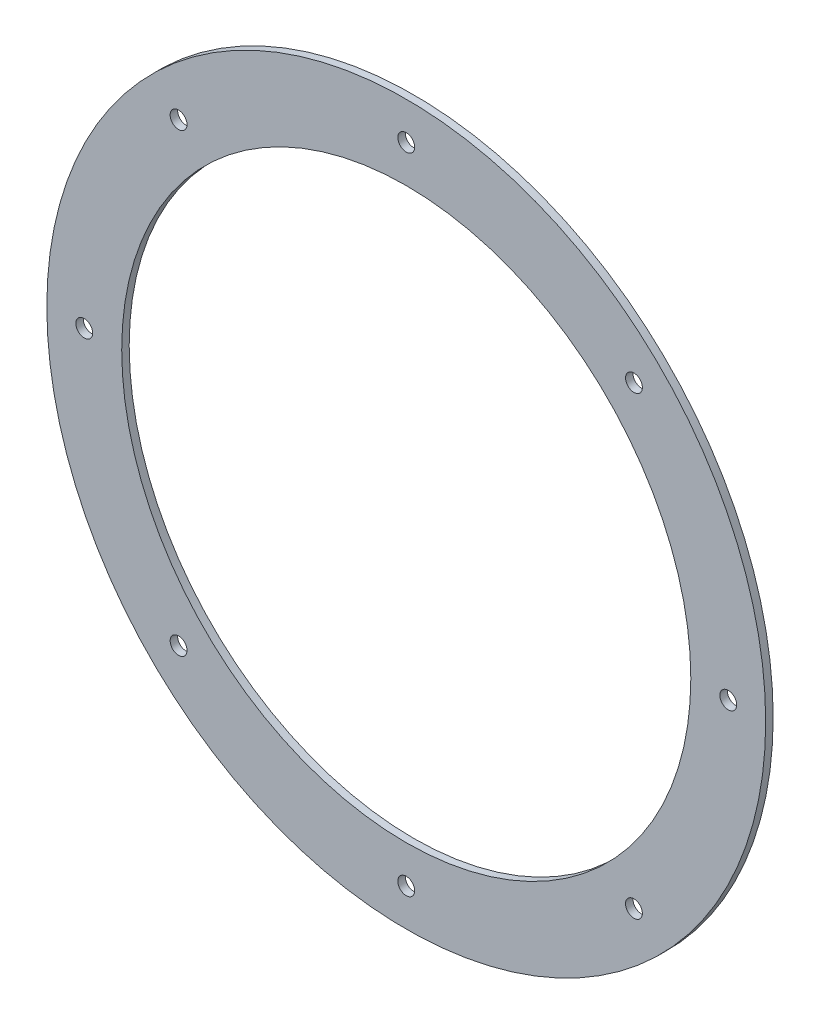
from build123d import *

# Parameters (mm, degrees)
SKETCH1_R          = 192
SKETCH1_R_2        = 152
BASE_FLANGE1_DEPTH = 4
SKETCH2_R          = 4.5
CUT_EXTRUDE1_DEPTH = 10
CIRPATTERN1_COUNT  = 8


# Sheet-metal steps are written as plain solids
with BuildPart() as part:
    # Sketch1 → Base-Flange1 (new body)
    with BuildSketch(Plane.XY):
        Circle(SKETCH1_R)
        Circle(SKETCH1_R_2, mode=Mode.SUBTRACT)
    extrude(amount=-BASE_FLANGE1_DEPTH)

    # Sketch2 → Cut-Extrude1 (cut)
    with BuildSketch(Plane.XY):
        with Locations((0, 172)):
            Circle(SKETCH2_R)
    cut_extrude1 = extrude(amount=-CUT_EXTRUDE1_DEPTH, mode=Mode.SUBTRACT)

    # CirPattern1: Cut-Extrude1 ×8 about axis
    cirpattern1_axis = Axis((0, 0, 0), (0, 0, 1))
    for i in range(1, CIRPATTERN1_COUNT):
        add(cut_extrude1.rotate(cirpattern1_axis, i * 360 / CIRPATTERN1_COUNT), mode=Mode.SUBTRACT)


solid = part.part
